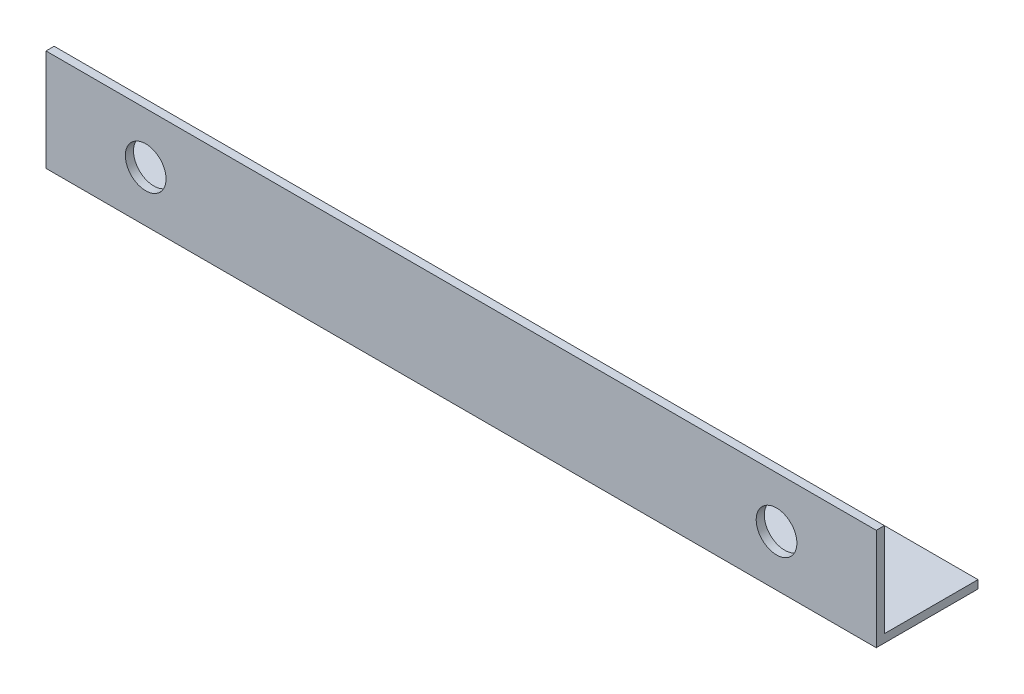
from build123d import *

# Parameters (mm, degrees)
EXTRUDE_1_DEPTH     = 204
SKETCH_2_R          = 5
CUT_EXTRUDE_1_DEPTH = 208.04105873


with BuildPart() as part:
    # Эскиз1 → Вытянуть-Тонкостенный1 (new body)
    with BuildSketch(Plane(origin=(0, 0, 0), x_dir=(0, 0, -1), z_dir=(1, 0, 0))):
        Polygon((0, 25), (0, 0), (25, 0), (25, 2), (2, 2), (2, 25), align=None)
    extrude(amount=EXTRUDE_1_DEPTH)

    # Эскиз2 → Вырез-Вытянуть1 (cut, through all)
    with BuildSketch(Plane.XY):
        with Locations((24.5, 12.5)):
            Circle(SKETCH_2_R)
        with Locations((179.5, 12.5)):
            Circle(SKETCH_2_R)
    extrude(amount=-CUT_EXTRUDE_1_DEPTH, mode=Mode.SUBTRACT)


solid = part.part
